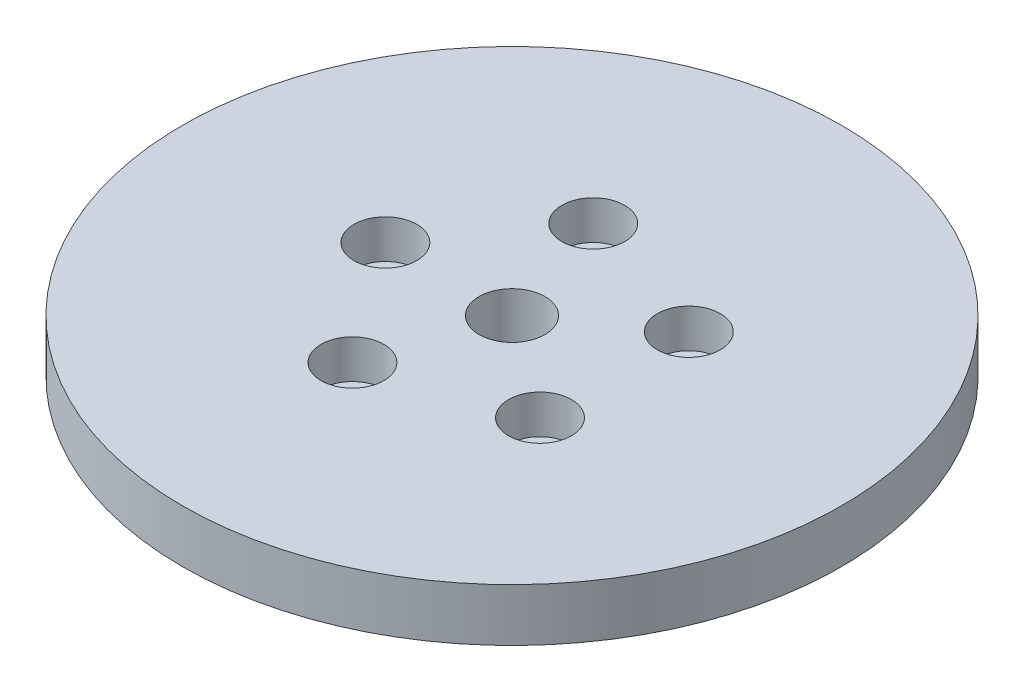
from build123d import *

# Parameters (mm, degrees)
SKETCH1_R           = 75
BOSS_EXTRUDE1_DEPTH = 12
SKETCH2_R           = 7.5
CUT_EXTRUDE1_DEPTH  = 107.742681248
SKETCH3_R           = 7.155815761
CUT_EXTRUDE2_DEPTH  = 8.814392398
CIRPATTERN1_COUNT   = 5


with BuildPart() as part:
    # Sketch1 → Boss-Extrude1 (new body)
    with BuildSketch(Plane(origin=(0, 0, 0), x_dir=(1, 0, 0), z_dir=(0, 1, 0))):
        Circle(SKETCH1_R)
    extrude(amount=BOSS_EXTRUDE1_DEPTH)

    # Sketch2 → Cut-Extrude1 (cut, through all)
    with BuildSketch(Plane(origin=(0, 0, 0), x_dir=(1, 0, 0), z_dir=(0, 1, 0))):
        Circle(SKETCH2_R)
    extrude(amount=CUT_EXTRUDE1_DEPTH, mode=Mode.SUBTRACT)

    # Sketch3 → Cut-Extrude2 (cut)
    with BuildSketch(Plane(origin=(0, 12, 0), x_dir=(1, 0, 0), z_dir=(0, 1, 0))):
        with Locations((-28.813602006, 0)):
            Circle(SKETCH3_R)
    cut_extrude2 = extrude(amount=-CUT_EXTRUDE2_DEPTH, mode=Mode.SUBTRACT)

    # CirPattern1: Cut-Extrude2 ×5 about axis
    cirpattern1_axis = Axis((0, 0, 0), (0, 1, 0))
    for i in range(1, CIRPATTERN1_COUNT):
        add(cut_extrude2.rotate(cirpattern1_axis, i * 360 / CIRPATTERN1_COUNT), mode=Mode.SUBTRACT)


solid = part.part
